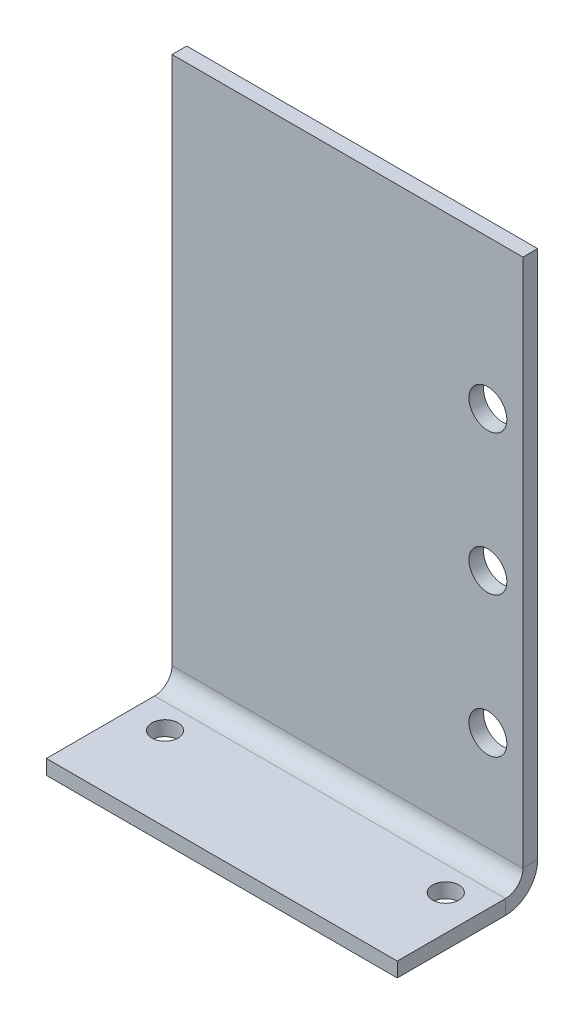
from build123d import *

# Parameters (mm, degrees)
BASE_FLANGE1_DEPTH = 63.5
SKETCH6_R          = 2.38125
CUT_EXTRUDE1_DEPTH = 25.4
SKETCH7_R          = 3.430168193
CUT_EXTRUDE2_DEPTH = 25.4


# Sheet-metal steps are written as plain solids
with BuildPart() as part:
    # Sketch1 → Base-Flange1 (new body)
    with BuildSketch(Plane(origin=(0, 0, 0), x_dir=(0, 0, -1), z_dir=(1, 0, 0))):
        with BuildLine():
            Line((-25.4, 0), (-5.83184, 0))
            ThreePointArc((-5.83184, 0), (-1.708106389, 1.708106389), (0, 5.83184))
            Line((0, 5.83184), (0, 101.6))
            Line((0, 101.6), (-2.65684, 101.6))
            Line((-2.65684, 101.6), (-2.65684, 5.83184))
            ThreePointArc((-2.65684, 5.83184), (-3.58677597, 3.58677597), (-5.83184, 2.65684))
            Line((-5.83184, 2.65684), (-25.4, 2.65684))
            Line((-25.4, 2.65684), (-25.4, 0))
        make_face()
    extrude(amount=BASE_FLANGE1_DEPTH)

    # Sketch6 → Cut-Extrude1 (cut)
    with BuildSketch(Plane(origin=(0, 2.65684, 0), x_dir=(1, 0, 0), z_dir=(0, 1, 0))):
        with Locations(Location((6.35, -10.27684, 0), (0, 0, 270))):
            Circle(SKETCH6_R)
        with Locations(Location((57.15, -10.27684, 0), (0, 0, 270))):
            Circle(SKETCH6_R)
    extrude(amount=-CUT_EXTRUDE1_DEPTH, mode=Mode.SUBTRACT)

    # Sketch7 → Cut-Extrude2 (cut)
    with BuildSketch(Plane.XY.offset(2.65684)):
        with Locations((57.15, 49.268253676)):
            Circle(SKETCH7_R)
        with Locations((57.15, 74.668253676)):
            Circle(SKETCH7_R)
        with Locations((57.15, 23.868253676)):
            Circle(SKETCH7_R)
    extrude(amount=-CUT_EXTRUDE2_DEPTH, mode=Mode.SUBTRACT)


solid = part.part
